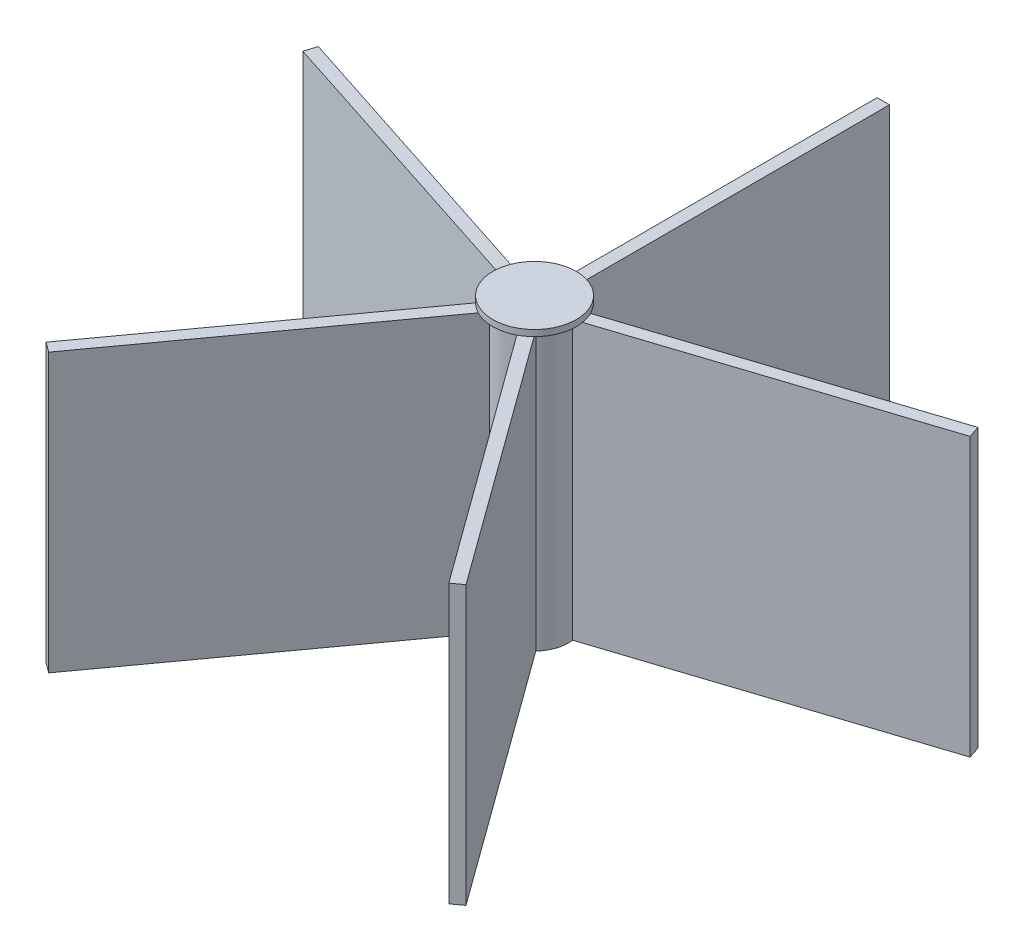
from build123d import *

# Parameters (mm, degrees)
EXTRUDE_THIN2_OUTLINE_R   = 5.5
EXTRUDE_THIN2_OUTLINE_R_2 = 3.5
EXTRUDE_THIN2_DEPTH       = 45
EXTRUDE_THIN2_2_OUTLINE_R = 3.5
EXTRUDE_THIN2_2_DEPTH     = 2
EXTRUDE_THIN2_START       = 43
EXTRUDE_THIN2_3_OUTLINE_R = 3.5
EXTRUDE_THIN2_3_DEPTH     = 2
EXTRUDE_THIN2_4_DEPTH     = 45
EXTRUDE_THIN2_5_DEPTH     = 45
EXTRUDE_THIN2_6_DEPTH     = 45
EXTRUDE_THIN2_7_DEPTH     = 45
EXTRUDE_THIN2_8_OUTLINE_W = 2
EXTRUDE_THIN2_8_OUTLINE_H = 52
EXTRUDE_THIN2_8_DEPTH     = 45
SKETCH4_R                 = 5.5
BOSS_EXTRUDE2_DEPTH       = 0.001
SKETCH6_R                 = 6.759527971
BOSS_EXTRUDE3_DEPTH       = 1
SCALE1_SCALE              = 1.5


# Read off the part's stored shape, not the designer's step: Extrude-Thin2
with BuildPart() as part:
    # Extrude-Thin2 outline → Extrude-Thin2 (new body)
    with BuildSketch(Plane(origin=(0, 0, 0), x_dir=(1, 0, 0), z_dir=(0, 1, 0))):
        Circle(EXTRUDE_THIN2_OUTLINE_R)
        Circle(EXTRUDE_THIN2_OUTLINE_R_2, mode=Mode.SUBTRACT)
    extrude(amount=EXTRUDE_THIN2_DEPTH)

    # Extrude-Thin2 2 outline → Extrude-Thin2 2 (add)
    with BuildSketch(Plane(origin=(0, 0, 0), x_dir=(1, 0, 0), z_dir=(0, 1, 0))):
        Circle(EXTRUDE_THIN2_2_OUTLINE_R)
    extrude(amount=EXTRUDE_THIN2_2_DEPTH)

    # Extrude-Thin2 3 outline → Extrude-Thin2 3 (add)
    with BuildSketch(Plane(origin=(0, 0, 0), x_dir=(1, 0, 0), z_dir=(0, 1, 0)).offset(EXTRUDE_THIN2_START)):
        Circle(EXTRUDE_THIN2_3_OUTLINE_R)
    extrude(amount=EXTRUDE_THIN2_3_DEPTH)



with BuildPart() as body_2:
    # Extrude-Thin2 4 outline → Extrude-Thin2 4 (new body)
    with BuildSketch(Plane(origin=(0, 0, 0), x_dir=(1, 0, 0), z_dir=(0, 1, 0))):
        Polygon((-3.970737329, 2.341632991), (-53.425676176, 18.410516698), (-54.043710165, 16.508403666), (-4.588771318, 0.439519958), align=None)
    extrude(amount=EXTRUDE_THIN2_4_DEPTH)


with BuildPart() as body_3:
    # Extrude-Thin2 5 outline → Extrude-Thin2 5 (new body)
    with BuildSketch(Plane(origin=(0, 0, 0), x_dir=(1, 0, 0), z_dir=(0, 1, 0))):
        Polygon((-3.45405063, -3.052791222), (-34.018883749, -45.12167493), (-32.40084976, -46.297245434), (-1.836016641, -4.228361727), align=None)
    extrude(amount=EXTRUDE_THIN2_5_DEPTH)


with BuildPart() as body_4:
    # Extrude-Thin2 6 outline → Extrude-Thin2 6 (new body)
    with BuildSketch(Plane(origin=(0, 0, 0), x_dir=(1, 0, 0), z_dir=(0, 1, 0))):
        Polygon((1.836016641, -4.228361727), (32.40084976, -46.297245434), (34.018883749, -45.12167493), (3.45405063, -3.052791222), align=None)
    extrude(amount=EXTRUDE_THIN2_6_DEPTH)


with BuildPart() as body_5:
    # Extrude-Thin2 7 outline → Extrude-Thin2 7 (new body)
    with BuildSketch(Plane(origin=(0, 0, 0), x_dir=(1, 0, 0), z_dir=(0, 1, 0))):
        Polygon((4.588771318, 0.439519958), (54.043710165, 16.508403666), (53.425676176, 18.410516698), (3.970737329, 2.341632991), align=None)
    extrude(amount=EXTRUDE_THIN2_7_DEPTH)


with BuildPart() as body_6:
    # Extrude-Thin2 8 outline → Extrude-Thin2 8 (new body)
    with BuildSketch(Plane(origin=(0, 0, 0), x_dir=(1, 0, 0), z_dir=(0, 1, 0))):
        with Locations((0, 30.5)):
            Rectangle(EXTRUDE_THIN2_8_OUTLINE_W, EXTRUDE_THIN2_8_OUTLINE_H)
    extrude(amount=EXTRUDE_THIN2_8_DEPTH)


with BuildPart() as part_1:
    add(part.part)

    add(body_2.part)  # Boss-Extrude2 merges body 2

    add(body_3.part)  # Boss-Extrude2 merges body 3

    add(body_4.part)  # Boss-Extrude2 merges body 4

    add(body_5.part)  # Boss-Extrude2 merges body 5

    add(body_6.part)  # Boss-Extrude2 merges body 6
    # Sketch4 → Boss-Extrude2 (add)
    with BuildSketch(Plane(origin=(0, 45, 0), x_dir=(1, 0, 0), z_dir=(0, 1, 0))):
        with Locations(Location((0, 0, 0), (0, 0, 79.524318304))):
            Circle(SKETCH4_R)
    extrude(amount=BOSS_EXTRUDE2_DEPTH)

    # Sketch6 → Boss-Extrude3 (add)
    with BuildSketch(Plane(origin=(0, 45, 0), x_dir=(1, 0, 0), z_dir=(0, 1, 0))):
        with Locations(Location((0, 0, 0), (0, 0, 81.492473787))):
            Circle(SKETCH6_R)
    extrude(amount=BOSS_EXTRUDE3_DEPTH)


with BuildPart() as part_2:
    # Scale1: scaled about (0, 22.627935727, 1e-09)
    add(part_1.part.scale(SCALE1_SCALE).moved(Location((0, -11.313967864, -1e-09))))


solid = part_2.part
